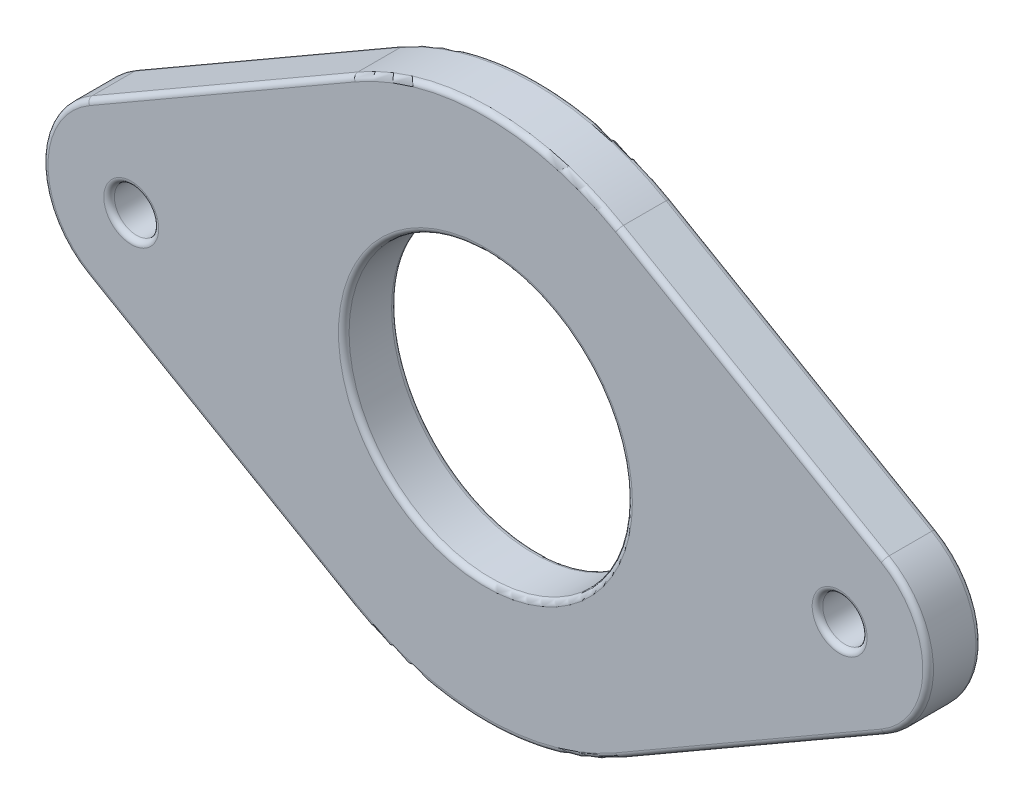
from build123d import *

# Parameters (mm, degrees)
SKETCH1_R           = 1.25
SKETCH1_R_2         = 8
BOSS_EXTRUDE1_DEPTH = 3
FILLET1_R           = 0.3


with BuildPart() as part:
    # Sketch1 → Boss-Extrude1 (new body)
    with BuildSketch(Plane.XY):
        with BuildLine():
            Line((-22.5, 4.330127019), (-7.5, 12.990381057))
            ThreePointArc((-7.5, 12.990381057), (0, 15), (7.5, 12.990381057))
            Line((7.5, 12.990381057), (22.5, 4.330127019))
            ThreePointArc((22.5, 4.330127019), (25, 0), (22.5, -4.330127019))
            Line((22.5, -4.330127019), (7.5, -12.990381057))
            ThreePointArc((7.5, -12.990381057), (0, -15), (-7.5, -12.990381057))
            Line((-7.5, -12.990381057), (-22.5, -4.330127019))
            ThreePointArc((-22.5, -4.330127019), (-25, 0), (-22.5, 4.330127019))
        make_face()
        with Locations((-20, 0)):
            Circle(SKETCH1_R, mode=Mode.SUBTRACT)
        with Locations((20, 0)):
            Circle(SKETCH1_R, mode=Mode.SUBTRACT)
        Circle(SKETCH1_R_2, mode=Mode.SUBTRACT)
    extrude(amount=BOSS_EXTRUDE1_DEPTH)

    # Fillet1
    fillet1_edges = [part.edges().sort_by_distance(p)[0] for p in [
        (18.75, 0, 0),
        (-21.25, 0, 0),
        (-8, 0, 0),
        (-15, -8.660254038, 0),
        (0, -15, 0),
        (15, -8.660254038, 0),
        (25, 0, 0),
        (15, 8.660254038, 0),
        (0, 15, 0),
        (-15, 8.660254038, 0),
        (-25, 0, 0),
        (18.75, 0, 3),
        (-8, 0, 3),
        (-15, 8.660254038, 3),
        (0, 15, 3),
        (15, 8.660254038, 3),
        (25, 0, 3),
        (15, -8.660254038, 3),
        (0, -15, 3),
        (-15, -8.660254038, 3),
        (-25, 0, 3),
        (-21.25, 0, 3),
    ]]
    fillet(fillet1_edges, radius=FILLET1_R)


solid = part.part
